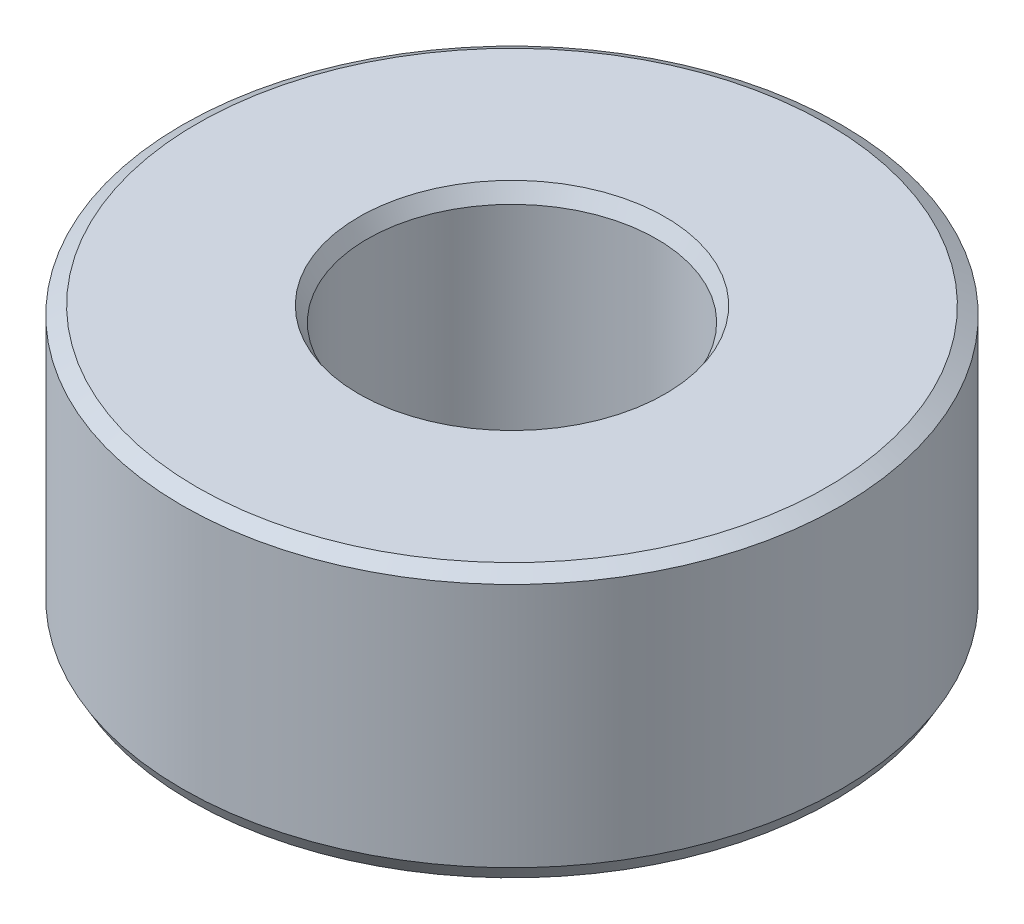
from build123d import *
from OCP.BRepFilletAPI import BRepFilletAPI_MakeChamfer

# Parameters (mm, degrees)
SKETCH1_R           = 37.5
BOSS_EXTRUDE1_DEPTH = 30.550542079
SKETCH2_R           = 16.461967871
CUT_EXTRUDE1_DEPTH  = 62.203232115
CHAMFER1_SIZE       = 0.969299613
CHAMFER1_SIZE2      = 1.678876177


with BuildPart() as part:
    # Sketch1 → Boss-Extrude1 (new body)
    with BuildSketch(Plane(origin=(0, 0, 0), x_dir=(1, 0, 0), z_dir=(0, 1, 0))):
        Circle(SKETCH1_R)
    extrude(amount=BOSS_EXTRUDE1_DEPTH)

    # Sketch2 → Cut-Extrude1 (cut, through all)
    with BuildSketch(Plane(origin=(0, 0, 0), x_dir=(1, 0, 0), z_dir=(0, 1, 0))):
        Circle(SKETCH2_R)
    extrude(amount=CUT_EXTRUDE1_DEPTH, mode=Mode.SUBTRACT)

    # Chamfer1: one chamfer whose edges measure the first distance from different faces: ONE call of the kernel's chamfer builder (chamfer() names one face for all edges)
    chamfer1_edges_1 = [part.edges().sort_by_distance(p)[0] for p in [
        (-16.461967871, 30.550542079, 0),
    ]]
    chamfer1_side_1 = [part.faces().sort_by_distance(p)[0] for p in [
        (-36.439339828, 30.550542079, 0),
    ]]
    chamfer1_edges_2 = [part.edges().sort_by_distance(p)[0] for p in [
        (-16.461967871, 0, 0),
    ]]
    chamfer1_side_2 = [part.faces().sort_by_distance(p)[0] for p in [
        (-16.461967871, 15.27527104, 0),
    ]]
    chamfer1_edges_3 = [part.edges().sort_by_distance(p)[0] for p in [
        (-37.5, 0, 0),
    ]]
    chamfer1_side_3 = [part.faces().sort_by_distance(p)[0] for p in [
        (-36.439339828, 0, 0),
    ]]
    chamfer1_edges_4 = [part.edges().sort_by_distance(p)[0] for p in [
        (-37.5, 30.550542079, 0),
    ]]
    chamfer1_side_4 = [part.faces().sort_by_distance(p)[0] for p in [
        (-37.5, 15.27527104, 0),
    ]]
    chamfer1 = BRepFilletAPI_MakeChamfer(part.part.solid().wrapped)
    for e in chamfer1_edges_1:
        chamfer1.Add(CHAMFER1_SIZE, CHAMFER1_SIZE2, e.wrapped, chamfer1_side_1[0].wrapped)  # the first distance lies on this face
    for e in chamfer1_edges_2:
        chamfer1.Add(CHAMFER1_SIZE, CHAMFER1_SIZE2, e.wrapped, chamfer1_side_2[0].wrapped)  # the first distance lies on this face
    for e in chamfer1_edges_3:
        chamfer1.Add(CHAMFER1_SIZE, CHAMFER1_SIZE2, e.wrapped, chamfer1_side_3[0].wrapped)  # the first distance lies on this face
    for e in chamfer1_edges_4:
        chamfer1.Add(CHAMFER1_SIZE, CHAMFER1_SIZE2, e.wrapped, chamfer1_side_4[0].wrapped)  # the first distance lies on this face
    add(Compound.cast(chamfer1.Shape()), mode=Mode.REPLACE)


solid = part.part
